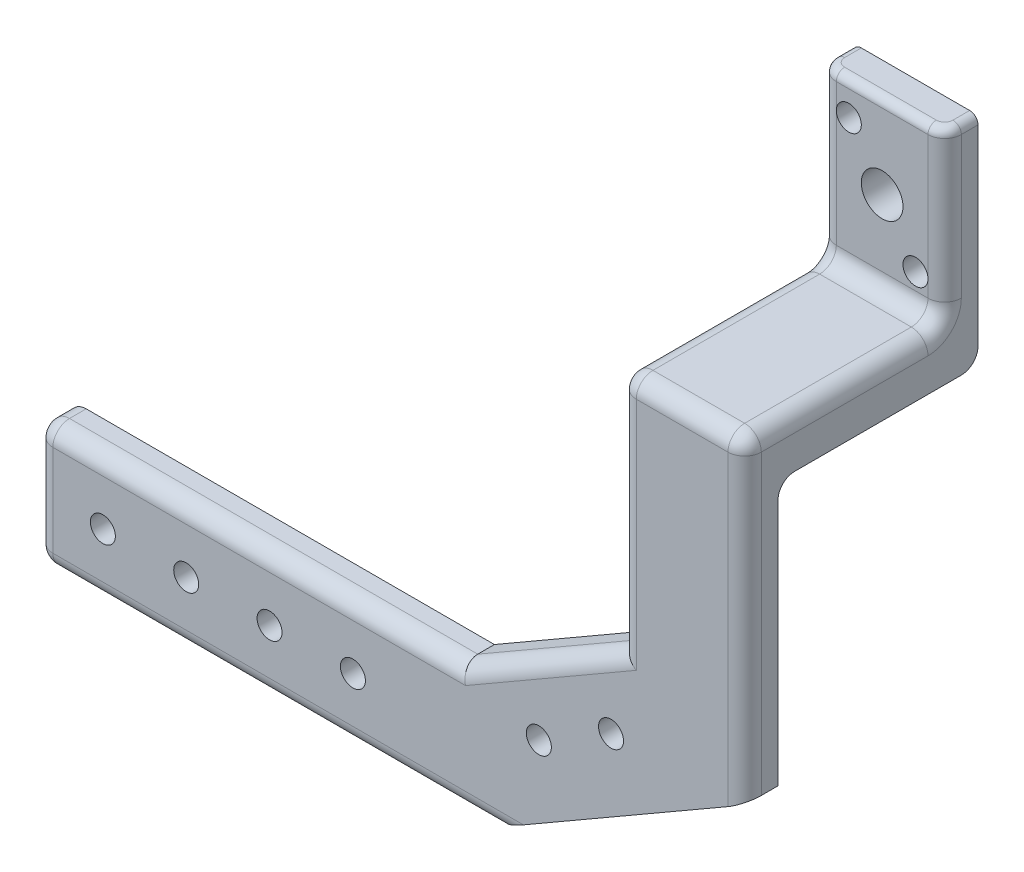
from build123d import *

# Parameters (mm, degrees)
SKETCH_1_W          = 15
SKETCH_1_H          = 26
SKETCH_1_R          = 2.5
SKETCH_1_R_2        = 1.5
EXTRUDE_1_DEPTH     = 4
SKETCH_14_W         = 15
SKETCH_14_H         = 6
EXTRUDE_4_DEPTH     = 20
EXTRUDE_5_DEPTH     = 4
SKETCH_17_W         = 40
SKETCH_17_H         = 10
CUT_EXTRUDE_3_DEPTH = 1.5
SKETCH_18_R         = 1.5
CUT_EXTRUDE_4_DEPTH = 2.5
CUT_EXTRUDE_5_DEPTH = 1.5
SKETCH_20_R         = 1.5
CUT_EXTRUDE_6_DEPTH = 2.5
FILLET_1_R          = 2
FILLET_2_R          = 1


with BuildPart() as part:
    # 草图1 → 凸台-拉伸1 (new body)
    with BuildSketch(Plane.XY):
        with Locations((0, -3)):
            Rectangle(SKETCH_1_W, SKETCH_1_H)
        Circle(SKETCH_1_R, mode=Mode.SUBTRACT)
        with Locations((-4, 6)):
            Circle(SKETCH_1_R_2, mode=Mode.SUBTRACT)
        with Locations((4, -6)):
            Circle(SKETCH_1_R_2, mode=Mode.SUBTRACT)
    extrude(amount=EXTRUDE_1_DEPTH)

    # 草图14 → 凸台-拉伸4 (add)
    with BuildSketch(Plane.XY.offset(4)):
        with Locations((0, -13)):
            Rectangle(SKETCH_14_W, SKETCH_14_H)
    extrude(amount=EXTRUDE_4_DEPTH)

    # 草图15 → 凸台-拉伸5 (add)
    with BuildSketch(Plane.XY.offset(24)):
        Polygon((-7.5, -10), (-7.5, -39.01879788), (-26.52, -50), (-77.5, -50), (-77.5, -65), (-22.5, -65), (7.5, -47.679491924), (7.5, -10), align=None)
    extrude(amount=EXTRUDE_5_DEPTH)

    # 草图17 → 切除-拉伸3 (cut)
    with BuildSketch(Plane(origin=(0, 0, 24), x_dir=(-1, 0, 0), z_dir=(0, 0, -1))):
        with Locations((54.5, -57.5)):
            Rectangle(SKETCH_17_W, SKETCH_17_H)
    extrude(amount=-CUT_EXTRUDE_3_DEPTH, mode=Mode.SUBTRACT)

    # 草图18 → 切除-拉伸4 (cut)
    with BuildSketch(Plane(origin=(0, 0, 25.5), x_dir=(-1, 0, 0), z_dir=(0, 0, -1))):
        with Locations((39.5, -57.5)):
            Circle(SKETCH_18_R)
        with Locations((49.5, -57.5)):
            Circle(SKETCH_18_R)
        with Locations((59.5, -57.5)):
            Circle(SKETCH_18_R)
        with Locations((69.5, -57.5)):
            Circle(SKETCH_18_R)
    extrude(amount=-CUT_EXTRUDE_4_DEPTH, mode=Mode.SUBTRACT)

    # 草图19 → 切除-拉伸5 (cut)
    with BuildSketch(Plane(origin=(0, 0, 24), x_dir=(-1, 0, 0), z_dir=(0, 0, -1))):
        Polygon((6.699491924, -41.443375673), (24.02, -51.443375673), (19.02, -60.103629711), (1.699491924, -50.103629711), align=None)
    extrude(amount=-CUT_EXTRUDE_5_DEPTH, mode=Mode.SUBTRACT)

    # 草图20 → 切除-拉伸6 (cut)
    with BuildSketch(Plane(origin=(0, 0, 25.5), x_dir=(-1, 0, 0), z_dir=(0, 0, -1))):
        with Locations((8.529618943, -48.273502692)):
            Circle(SKETCH_20_R)
        with Locations((17.189872981, -53.273502692)):
            Circle(SKETCH_20_R)
    extrude(amount=-CUT_EXTRUDE_6_DEPTH, mode=Mode.SUBTRACT)

    # 圆角1
    fillet_1_edges = [part.edges().sort_by_distance(p)[0] for p in [
        (-7.5, 0, 4),
        (7.5, 0, 4),
        (-7.5, -10, 16),
        (0, -10, 4),
        (7.5, -10, 16),
        (0, -16, 24),
        (-77.5, -50, 26),
        (-77.5, -65, 26),
        (0, -10, 28),
        (-7.5, -24.50939894, 28),
        (-17.01, -44.50939894, 28),
        (-52.01, -50, 28),
        (-77.5, -57.5, 28),
        (-50, -65, 28),
        (7.5, -28.839745962, 28),
        (0, -16, 0),
    ]]
    fillet(fillet_1_edges, radius=FILLET_1_R - 0.0001)  # a hair under: the kernel refuses the full size

    # 圆角2
    fillet_2_edges = [part.edges().sort_by_distance(p)[0] for p in [
        (7.5, 10, 1.00005),
        (-7.5, 10, 1.00005),
        (0, 10, 4),
        (-6.914242852, 10, 3.414242852),
        (6.914242852, 10, 3.414242852),
    ]]
    fillet(fillet_2_edges, radius=FILLET_2_R)


solid = part.part
